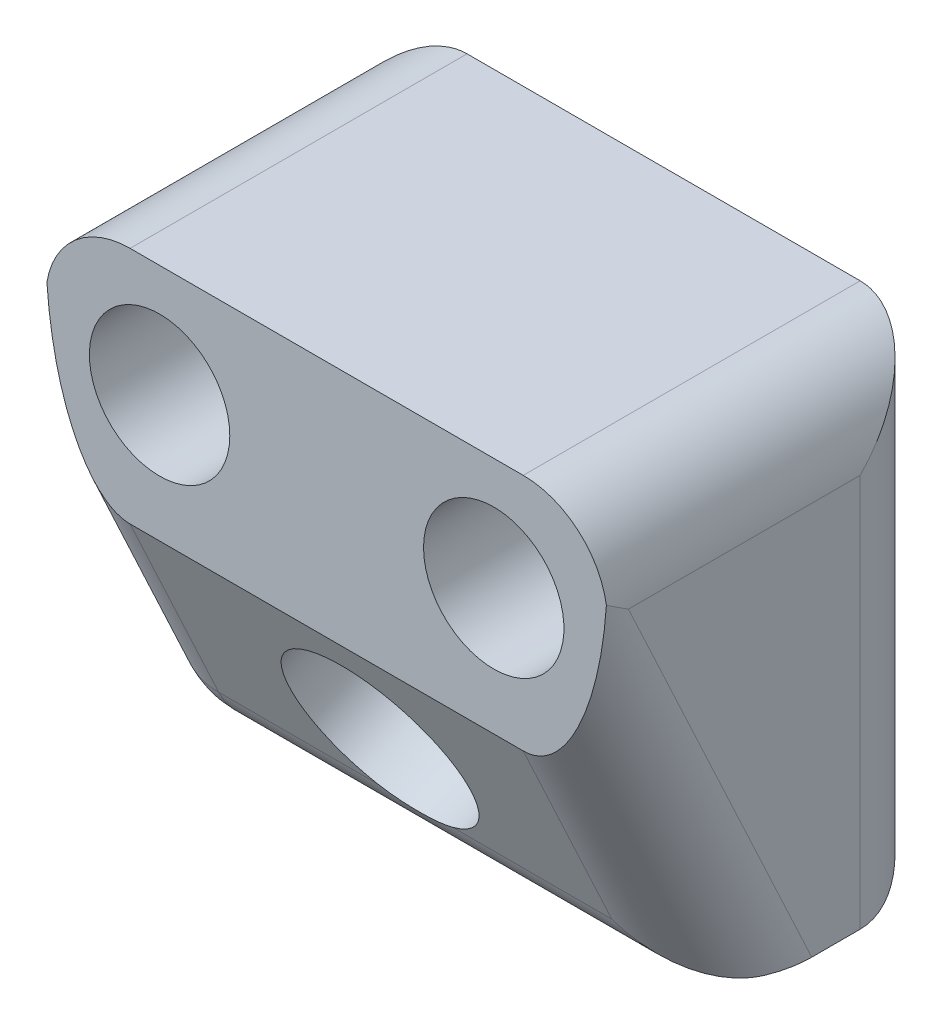
from build123d import *

# Parameters (mm, degrees)
CROQUIS1_W              = 20
CROQUIS1_H              = 17
CROQUIS1_R              = 2.5
SALIENTE_EXTRUIR2_DEPTH = 12
CORTAR_EXTRUIR2_DEPTH   = 20
CROQUIS5_R              = 3.25
CORTAR_EXTRUIR3_DEPTH   = 20
CORTAR_EXTRUIR4_START   = 4
CORTAR_EXTRUIR4_DEPTH   = 20
REDONDEO1_R             = 3


with BuildPart() as part:
    # Croquis1 → Saliente-Extruir2 (new body)
    with BuildSketch(Plane.XY):
        with Locations((-34.464447367, 6.145669291)):
            Rectangle(CROQUIS1_W, CROQUIS1_H)
        with Locations((-40.414447367, 10.645669291)):
            Circle(CROQUIS1_R, mode=Mode.SUBTRACT)
        with Locations(Location((-28.514447367, 10.645669291, 0), (0, 0, 180))):
            Circle(CROQUIS1_R, mode=Mode.SUBTRACT)
    extrude(amount=SALIENTE_EXTRUIR2_DEPTH)

    # Croquis4 → Cortar-Extruir2 (cut)
    with BuildSketch(Plane(origin=(-24.464447367, 0, 0), x_dir=(0, 0, -1), z_dir=(1, 0, 0))):
        Polygon((-12, 6.145669291), (-8.036384906, -2.354330709), (-12, -2.354330709), align=None)
    extrude(amount=-CORTAR_EXTRUIR2_DEPTH, mode=Mode.SUBTRACT)

    # Croquis5 → Cortar-Extruir3 (cut)
    with BuildSketch(Plane(origin=(0, 11.801993797, 14.637587434), x_dir=(1, 0, 0), z_dir=(0, 0.42261826174069395, -0.9063077870366525))):
        with Locations(Location((-34.464447367, 10.741063562, 0), (0, 0, 90))):
            Circle(CROQUIS5_R)
    extrude(amount=CORTAR_EXTRUIR3_DEPTH, mode=Mode.SUBTRACT)

    # Croquis6 → Cortar-Extruir4 (cut)
    with BuildSketch(Plane(origin=(0, 11.801993797, 14.637587434), x_dir=(1, 0, 0), z_dir=(0, 0.42261826174069395, -0.9063077870366525)).offset(CORTAR_EXTRUIR4_START)):
        Polygon((-29.614705106, 10.741063562), (-32.039576236, 14.941063562), (-36.889318498, 14.941063562), (-39.314189628, 10.741063562), (-36.889318498, 6.541063562), (-32.039576236, 6.541063562), align=None)
    extrude(amount=CORTAR_EXTRUIR4_DEPTH, mode=Mode.SUBTRACT)

    # Redondeo1
    # the kernel refuses this fillet: 3 mm, written as the material it takes off along each edge
    with BuildSketch(Plane(origin=(-41.464447367, 0.645669291, 3), x_dir=(0, 0, -1), z_dir=(-1, 0, 0))) as redondeo1_piece_1_section:
        Polygon((0, 0), (REDONDEO1_R, 0), (REDONDEO1_R, REDONDEO1_R), (0, REDONDEO1_R), align=None)
    redondeo1_piece_1 = extrude(amount=REDONDEO1_R, mode=Mode.PRIVATE)
    redondeo1_piece_1 = redondeo1_piece_1 - Plane(origin=(-41.464447367, 0.645669291, 3), x_dir=(0, 0.7071067811865475, 0.7071067811865475), z_dir=(-1, 0, 0)) * Sphere(REDONDEO1_R, mode=Mode.PRIVATE)
    add(redondeo1_piece_1, mode=Mode.SUBTRACT)
    with BuildSketch(Plane(origin=(-41.464447367, 0.645669291, 6.125174123), x_dir=(0, -0.422618261740694, 0.9063077870366527), z_dir=(-1, 0, 0))) as redondeo1_piece_2_section:
        Polygon((0, 0), (REDONDEO1_R, 0), (REDONDEO1_R, -REDONDEO1_R * 0.637070260807), (REDONDEO1_R * 0.422618261741, -REDONDEO1_R * 0.906307787037), align=None)
    redondeo1_piece_2 = extrude(amount=REDONDEO1_R, mode=Mode.PRIVATE)
    redondeo1_piece_2 = redondeo1_piece_2 - Plane(origin=(-41.464447367, 0.645669291, 6.125174123), x_dir=(0, 0.8433914458128839, -0.5372996083468264), z_dir=(-1, 0, 0)) * Sphere(REDONDEO1_R, mode=Mode.PRIVATE)
    add(redondeo1_piece_2, mode=Mode.SUBTRACT)
    with BuildSketch(Plane(origin=(-44.464447367, 0.645669291, 0), x_dir=(0, 0, 1), z_dir=(0, 1, 0))) as redondeo1_piece_3:
        with BuildLine():
            CenterArc((REDONDEO1_R, REDONDEO1_R), REDONDEO1_R, 180, 90)
            Line((0, REDONDEO1_R), (0, 0))
            Line((0, 0), (REDONDEO1_R, 0))
        make_face()
    extrude(amount=21.5, mode=Mode.SUBTRACT)
    with BuildSketch(Plane(origin=(-44.464447367, 14.645669291, -7.5), x_dir=(1, 0, 0), z_dir=(0, 0, 1))) as redondeo1_piece_4:
        with BuildLine():
            CenterArc((REDONDEO1_R, -REDONDEO1_R), REDONDEO1_R, 90, 90)
            Line((0, -REDONDEO1_R), (0, 0))
            Line((0, 0), (REDONDEO1_R, 0))
        make_face()
    extrude(amount=27, mode=Mode.SUBTRACT)
    with BuildSketch(Plane(origin=(-24.464447367, 14.645669291, -7.5), x_dir=(-1, 0, 0), z_dir=(0, 0, 1))) as redondeo1_piece_5:
        with BuildLine():
            CenterArc((REDONDEO1_R, REDONDEO1_R), REDONDEO1_R, 180, 90)
            Line((0, REDONDEO1_R), (0, 0))
            Line((0, 0), (REDONDEO1_R, 0))
        make_face()
    extrude(amount=27, mode=Mode.SUBTRACT)
    with BuildSketch(Plane(origin=(-24.464447367, 22.145669291, 0), x_dir=(0, 0, 1), z_dir=(0, -1, 0))) as redondeo1_piece_6:
        with BuildLine():
            CenterArc((REDONDEO1_R, REDONDEO1_R), REDONDEO1_R, 180, 90)
            Line((0, REDONDEO1_R), (0, 0))
            Line((0, 0), (REDONDEO1_R, 0))
        make_face()
    extrude(amount=32, mode=Mode.SUBTRACT)
    with BuildSketch(Plane(origin=(-16.964447367, -2.354330709, 0), x_dir=(0, 1, 0), z_dir=(-1, 0, 0))) as redondeo1_piece_7:
        with BuildLine():
            CenterArc((REDONDEO1_R, -REDONDEO1_R), REDONDEO1_R, 90, 90)
            Line((0, -REDONDEO1_R), (0, 0))
            Line((0, 0), (REDONDEO1_R, 0))
        make_face()
    extrude(amount=24.5, mode=Mode.SUBTRACT)
    with BuildSketch(Plane(origin=(-44.464447367, -2.354330709, 3), x_dir=(0, 1, 0), z_dir=(0, 0, 1))) as redondeo1_piece_8:
        with BuildLine():
            CenterArc((REDONDEO1_R, -REDONDEO1_R), REDONDEO1_R, 90, 90)
            Line((0, -REDONDEO1_R), (0, 0))
            Line((0, 0), (REDONDEO1_R, 0))
        make_face()
    extrude(amount=3.125174123, mode=Mode.SUBTRACT)
    with BuildSketch(Plane(origin=(-44.464447367, 12.942977694, 15.169636963), x_dir=(0, 0.42261826174069395, -0.9063077870366526), z_dir=(0, -0.9063077870366526, -0.42261826174069395))) as redondeo1_piece_9:
        with BuildLine():
            CenterArc((REDONDEO1_R, REDONDEO1_R), REDONDEO1_R, 180, 90)
            Line((0, REDONDEO1_R), (0, 0))
            Line((0, 0), (REDONDEO1_R, 0))
        make_face()
    extrude(amount=14.967501529, mode=Mode.SUBTRACT)
    with BuildSketch(Plane(origin=(-24.464447367, 12.942977694, 15.169636963), x_dir=(0, 0.4226182617406939, -0.9063077870366525), z_dir=(0, -0.9063077870366526, -0.42261826174069395))) as redondeo1_piece_10:
        with BuildLine():
            CenterArc((REDONDEO1_R, -REDONDEO1_R), REDONDEO1_R, 90, 90)
            Line((0, -REDONDEO1_R), (0, 0))
            Line((0, 0), (REDONDEO1_R, 0))
        make_face()
    extrude(amount=24.378712311, mode=Mode.SUBTRACT)
    with BuildSketch(Plane(origin=(-19.686420411, -2.354330709, 8.036384906), x_dir=(0, 0.9063077870366527, 0.4226182617406936), z_dir=(-1, 0, 0))) as redondeo1_piece_11:
        with BuildLine():
            CenterArc((REDONDEO1_R * 0.637070260807, REDONDEO1_R), REDONDEO1_R, 205, 65)
            Line((-REDONDEO1_R * 0.269237526229, REDONDEO1_R * 0.577381738259), (0, 0))
            Line((0, 0), (REDONDEO1_R * 0.637070260807, 0))
        make_face()
    extrude(amount=21.778026956, mode=Mode.SUBTRACT)


solid = part.part
